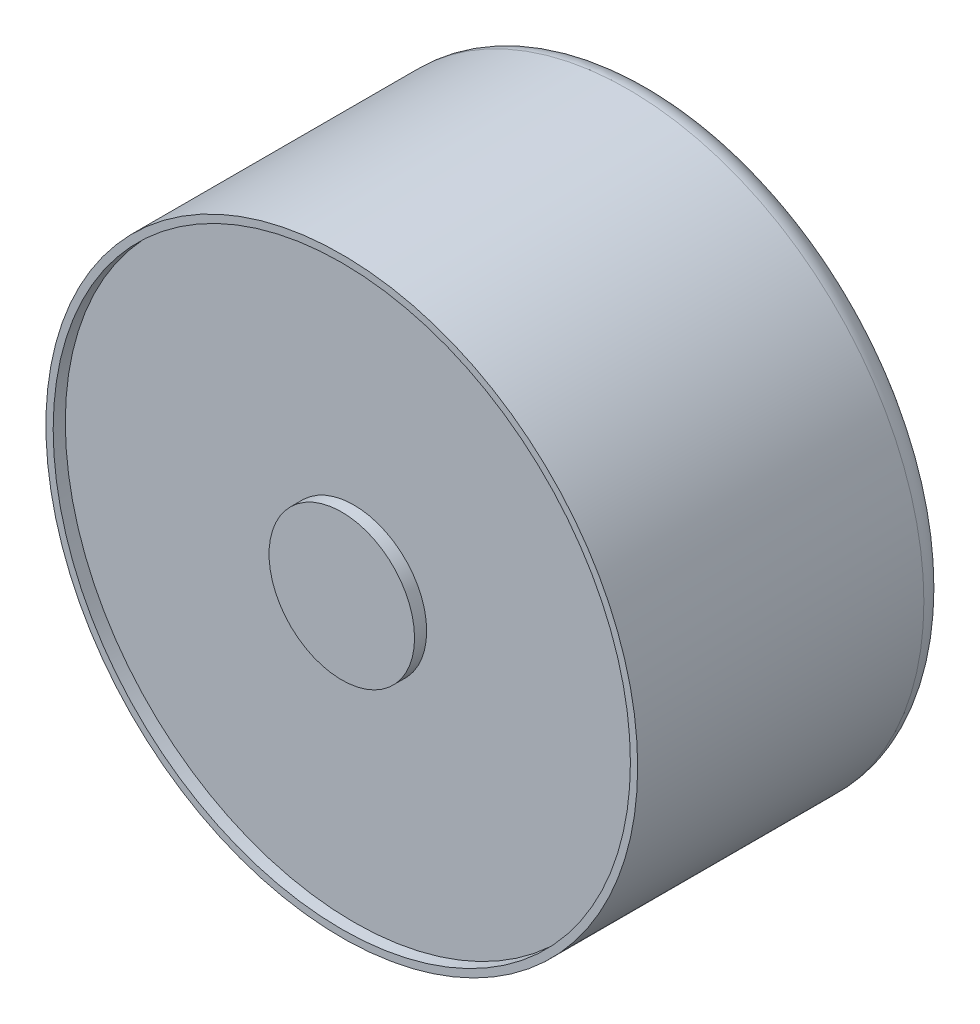
from build123d import *

# Parameters (mm, degrees)
SKETCH2_R           = 1
BOSS_EXTRUDE1_DEPTH = 6
CIRPATTERN1_COUNT   = 6


with BuildPart() as part:
    # Sketch1 → Revolve1 (revolve)
    with BuildSketch(Plane(origin=(0, 0, 0), x_dir=(1, 0, 0), z_dir=(0, 1, 0))):
        with BuildLine():
            Line((0, 0), (3, 0))
            Line((3, 0), (3, 0.5))
            Line((3, 0.5), (11.9, 0.5))
            Line((11.9, 0.5), (11.9, 0))
            Line((11.9, 0), (12.2, 0))
            Line((12.2, 0), (12.2, 11.8))
            ThreePointArc((12.2, 11.8), (11.907106781, 12.507106781), (11.2, 12.8))
            Line((11.2, 12.8), (3, 12.8))
            Line((3, 12.8), (3, 13.3))
            Line((3, 13.3), (0, 13.3))
            Line((0, 13.3), (0, 0))
        make_face()
    revolve(axis=Axis((0, 0, 0), (0, 0, -1)))

    # Sketch2 → Boss-Extrude1 (add)
    with BuildSketch(Plane(origin=(0, 0, -13.3), x_dir=(-1, 0, 0), z_dir=(0, 0, -1))):
        Circle(SKETCH2_R)
    extrude(amount=BOSS_EXTRUDE1_DEPTH)

    # Sketch4 → M1.6 Clearance Hole1 (revolve, cut)
    with BuildSketch(Plane(origin=(0, 8.25, -12.8), x_dir=(0, 1, 0), z_dir=(1, 0, 0))):
        Polygon((0, 0), (0, 3.600860619), (1, 3), (1, 0), align=None)
    m1_6_clearance_hole1 = revolve(axis=Axis((0, 8.25, -19.15), (0, 0, 1)), mode=Mode.SUBTRACT)

    # CirPattern1: M1.6 Clearance Hole1 ×6 about axis
    cirpattern1_axis = Axis((0, 0, -12.8), (0, 0, 1))
    for i in range(1, CIRPATTERN1_COUNT):
        add(m1_6_clearance_hole1.rotate(cirpattern1_axis, i * 360 / CIRPATTERN1_COUNT), mode=Mode.SUBTRACT)


solid = part.part
